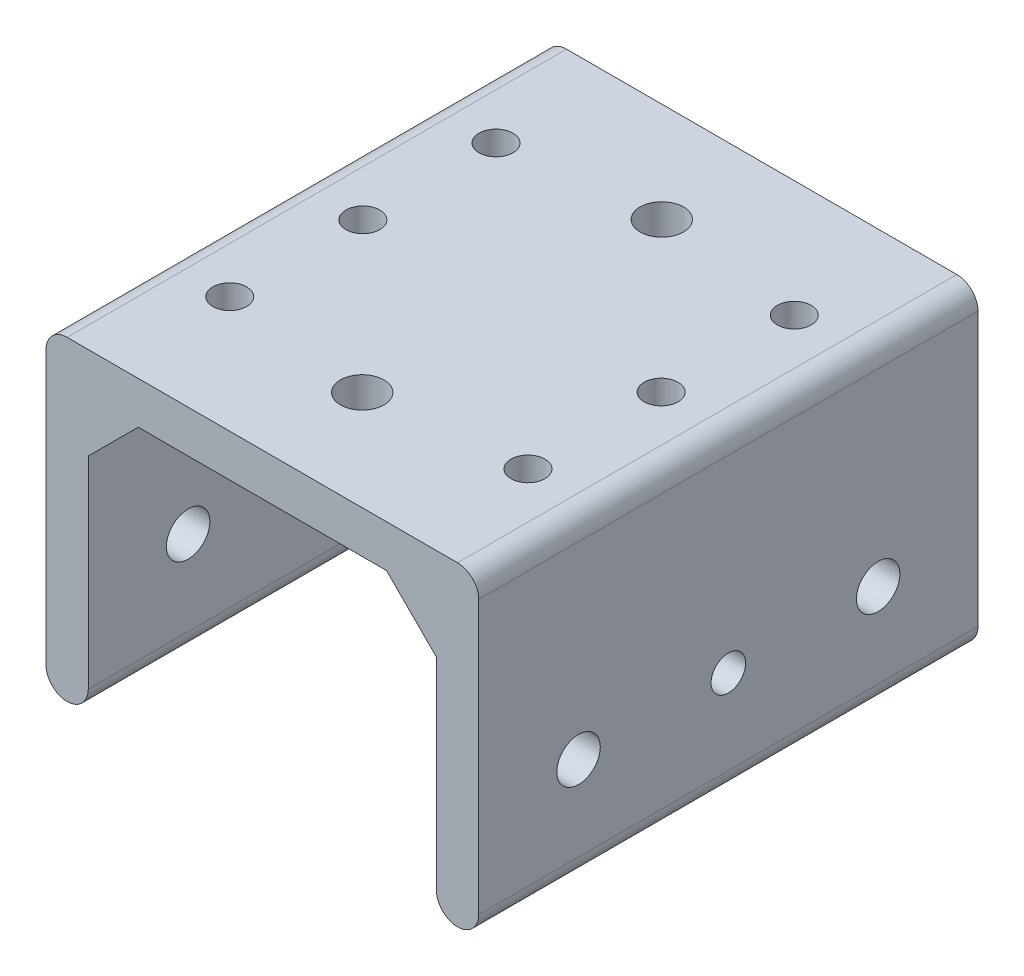
from build123d import *

# Parameters (mm, degrees)
BOSS_EXTRUDE1_DEPTH           = 75
F_5_16_18_TAPPED_HOLE1_REACH  = 111.972
F_5_16_18_TAPPED_HOLE1_BORE_R = 3.2639
F_5_16_18_TAPPED_HOLE2_D      = 6.5278
SKETCH8_R                     = 2.6
CUT_EXTRUDE1_DEPTH            = 110.972346069
F_1_4_20_TAPPED_HOLE1_D       = 5.1054
F_1_4_20_TAPPED_HOLE1_DEPTH   = 13.851
FILLET1_R                     = 3.175


with BuildPart() as part:
    # Sketch1 → Boss-Extrude1 (new body)
    with BuildSketch(Plane.XY):
        Polygon((58.65, 33.52), (51.15, 41.02), (13.85, 41.02), (6.35, 33.52), (6.35, 0), (0, 0), (0, 41.02), (0, 47.37), (65, 47.37), (65, 41.02), (65, 0), (58.65, 0), align=None)
    extrude(amount=BOSS_EXTRUDE1_DEPTH)

    # 5/16-18 Tapped Hole1 bore → 5/16-18 Tapped Hole1 (cut, up to next)
    with BuildSketch(Plane.ZY, mode=Mode.PRIVATE) as f_5_16_18_tapped_hole1_sk1:
        with Locations((60, 15.87)):
            Circle(F_5_16_18_TAPPED_HOLE1_BORE_R)
    f_5_16_18_tapped_hole1_tool1 = extrude(f_5_16_18_tapped_hole1_sk1.sketch, amount=-F_5_16_18_TAPPED_HOLE1_REACH, mode=Mode.PRIVATE) & part.part
    # 5/16-18 Tapped Hole1 bore → 5/16-18 Tapped Hole1 (cut, up to next)
    with BuildSketch(Plane.ZY, mode=Mode.PRIVATE) as f_5_16_18_tapped_hole1_sk2:
        with Locations((15, 15.87)):
            Circle(F_5_16_18_TAPPED_HOLE1_BORE_R)
    f_5_16_18_tapped_hole1_tool2 = extrude(f_5_16_18_tapped_hole1_sk2.sketch, amount=-F_5_16_18_TAPPED_HOLE1_REACH, mode=Mode.PRIVATE) & part.part
    f_5_16_18_tapped_hole1_1 = f_5_16_18_tapped_hole1_tool1.solids().sort_by_distance((0, 15.87, 60))[0]
    add(f_5_16_18_tapped_hole1_1, mode=Mode.SUBTRACT)
    f_5_16_18_tapped_hole1_2 = f_5_16_18_tapped_hole1_tool2.solids().sort_by_distance((0, 15.87, 15))[0]
    add(f_5_16_18_tapped_hole1_2, mode=Mode.SUBTRACT)
    f_5_16_18_tapped_hole1 = f_5_16_18_tapped_hole1_1 + f_5_16_18_tapped_hole1_2  # 5/16-18 Tapped Hole1 as one shape, for the pattern or mirror that repeats it

    # Mirror1: 5/16-18 Tapped Hole1 across plane
    add(f_5_16_18_tapped_hole1.mirror(Plane.ZY.offset(-32.5)), mode=Mode.SUBTRACT)

    # 5/16-18 Tapped Hole2 (through all)
    with Locations(Plane(origin=(0, 47.37, 0), x_dir=(1, 0, 0), z_dir=(0, 1, 0))):
        with Locations((32.5, -15), (32.5, -60)):
            Hole(F_5_16_18_TAPPED_HOLE2_D / 2)

    # Sketch8 → Cut-Extrude1 (cut, through all)
    with BuildSketch(Plane.ZY):
        with Locations((37.5, 15.87)):
            Circle(SKETCH8_R)
    extrude(amount=-CUT_EXTRUDE1_DEPTH, mode=Mode.SUBTRACT)

    # 1/4-20 Tapped Hole1
    with Locations(Plane(origin=(0, 47.37, 0), x_dir=(1, 0, 0), z_dir=(0, 1, 0))):
        with Locations((54.9, -57.5), (54.9, -37.5), (54.9, -17.5)):
            f_1_4_20_tapped_hole1 = Hole(F_1_4_20_TAPPED_HOLE1_D / 2, depth=F_1_4_20_TAPPED_HOLE1_DEPTH)

    # Mirror2: 1/4-20 Tapped Hole1 across plane
    add(f_1_4_20_tapped_hole1.mirror(Plane.ZY.offset(-32.5)), mode=Mode.SUBTRACT)

    # Fillet1
    fillet1_edges = [part.edges().sort_by_distance(p)[0] for p in [
        (58.65, 0, 37.5),
        (65, 0, 37.5),
        (0, 0, 37.5),
        (6.35, 0, 37.5),
        (0, 47.37, 37.5),
        (65, 47.37, 37.5),
    ]]
    fillet(fillet1_edges, radius=FILLET1_R - 0.0001)  # a hair under: the kernel refuses the full size


solid = part.part
